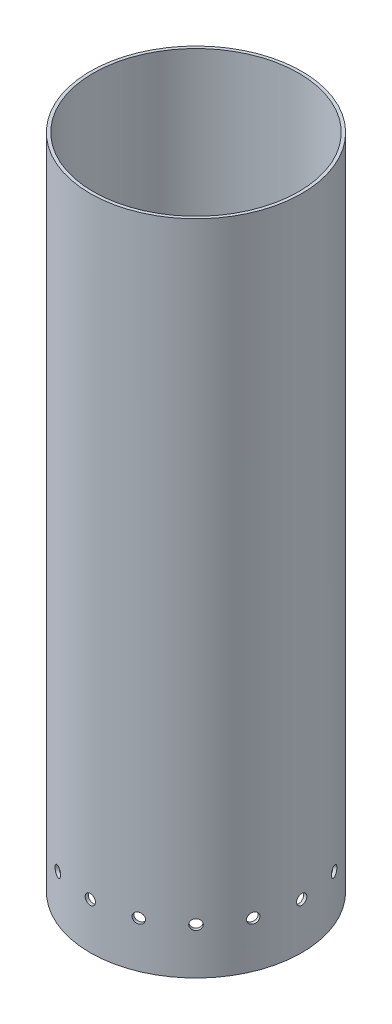
from build123d import *

# Parameters (mm, degrees)
SKETCH1_R           = 65.405
SKETCH1_R_2         = 63.5
BOSS_EXTRUDE1_DEPTH = 406.4
CUT_EXTRUDE3_REACH  = 433.914
SKETCH4_R           = 3.175
CIRPATTERN2_COUNT   = 16


with BuildPart() as part:
    # Sketch1 → Boss-Extrude1 (new body)
    with BuildSketch(Plane(origin=(0, 0, 0), x_dir=(1, 0, 0), z_dir=(0, 1, 0))):
        Circle(SKETCH1_R)
        Circle(SKETCH1_R_2, mode=Mode.SUBTRACT)
    extrude(amount=-BOSS_EXTRUDE1_DEPTH)

    # Sketch4 → Cut-Extrude3 (cut, up to next)
    with BuildSketch(Plane.XY.offset(65.405), mode=Mode.PRIVATE) as cut_extrude3_sk1:
        with Locations((0, -377.825)):
            Circle(SKETCH4_R)
    cut_extrude3_tool1 = extrude(cut_extrude3_sk1.sketch, amount=-CUT_EXTRUDE3_REACH, mode=Mode.PRIVATE) & part.part
    cut_extrude3 = cut_extrude3_tool1.solids().sort_by_distance((0, -377.825, 65.405))[0]
    add(cut_extrude3, mode=Mode.SUBTRACT)

    # CirPattern2: Cut-Extrude3 ×16 about axis
    cirpattern2_axis = Axis((0, -406.4, 0), (0, 1, 0))
    for i in range(1, CIRPATTERN2_COUNT):
        add(cut_extrude3.rotate(cirpattern2_axis, i * 360 / CIRPATTERN2_COUNT), mode=Mode.SUBTRACT)


solid = part.part
